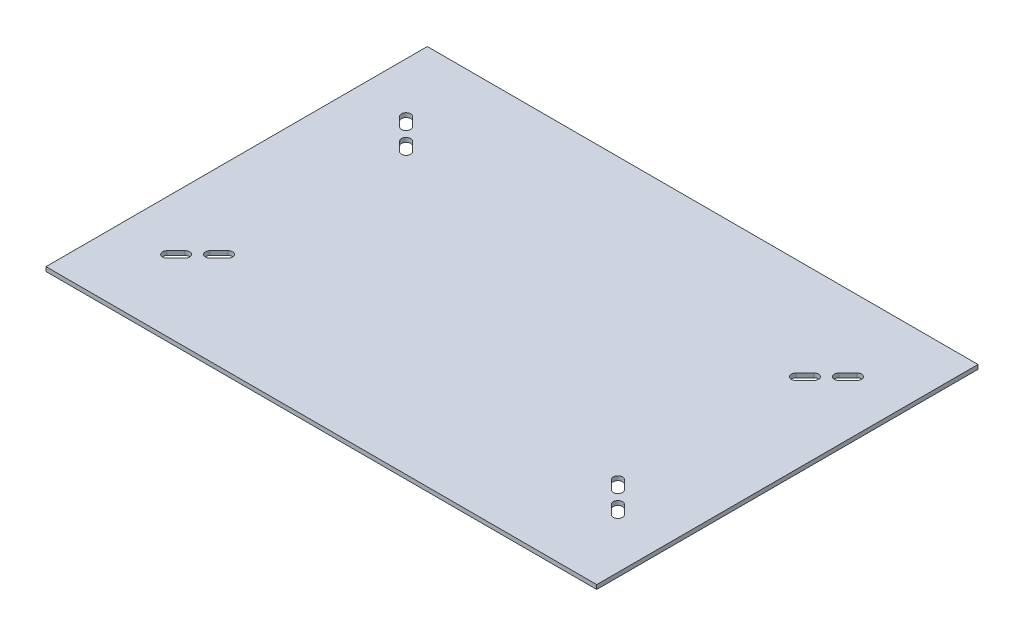
from build123d import *

# Parameters (mm, degrees)
SKETCH1_W          = 330.2
SKETCH1_H          = 228.6
BASE_PLATE_DEPTH   = 2.54
CUT_EXTRUDE9_DEPTH = 402.617294946


with BuildPart() as part:
    # Sketch1 → base plate (new body)
    with BuildSketch(Plane(origin=(0, 0, 0), x_dir=(1, 0, 0), z_dir=(0, 1, 0))):
        with Locations((165.1, -114.3)):
            Rectangle(SKETCH1_W, SKETCH1_H)
    extrude(amount=-BASE_PLATE_DEPTH)

    # Sketch3 → Cut-Extrude9 (cut, through all)
    with BuildSketch(Plane(origin=(0, 0, 0), x_dir=(1, 0, 0), z_dir=(0, 1, 0))):
        with BuildLine():
            Line((33.404828058, -178.606084521), (28.016674385, -183.994238194))
            ThreePointArc((28.016674385, -183.994238194), (28.016674385, -187.883325615), (31.905761806, -187.883325615))
            Line((31.905761806, -187.883325615), (37.293915479, -182.495171942))
            ThreePointArc((37.293915479, -182.495171942), (37.293915479, -178.606084521), (33.404828058, -178.606084521))
        make_face()
        with BuildLine():
            Line((44.775105348, -175.013982073), (50.163259021, -169.6258284))
            ThreePointArc((50.163259021, -169.6258284), (50.163259021, -165.736740979), (46.2741716, -165.736740979))
            Line((46.2741716, -165.736740979), (40.886017927, -171.124894652))
            ThreePointArc((40.886017927, -171.124894652), (40.886017927, -175.013982073), (44.775105348, -175.013982073))
        make_face()
        with BuildLine():
            ThreePointArc((31.905761806, -40.716674385), (28.016674385, -40.716674385), (28.016674385, -44.605761806))
            Line((28.016674385, -44.605761806), (33.404828058, -49.993915479))
            ThreePointArc((33.404828058, -49.993915479), (37.293915479, -49.993915479), (37.293915479, -46.104828058))
            Line((37.293915479, -46.104828058), (31.905761806, -40.716674385))
        make_face()
        with BuildLine():
            ThreePointArc((46.2741716, -62.863259021), (50.163259021, -62.863259021), (50.163259021, -58.9741716))
            Line((50.163259021, -58.9741716), (44.775105348, -53.586017927))
            ThreePointArc((44.775105348, -53.586017927), (40.886017927, -53.586017927), (40.886017927, -57.475105348))
            Line((40.886017927, -57.475105348), (46.2741716, -62.863259021))
        make_face()
        with BuildLine():
            Line((296.795171942, -49.993915479), (302.183325615, -44.605761806))
            ThreePointArc((302.183325615, -44.605761806), (302.183325615, -40.716674385), (298.294238194, -40.716674385))
            Line((298.294238194, -40.716674385), (292.906084521, -46.104828058))
            ThreePointArc((292.906084521, -46.104828058), (292.906084521, -49.993915479), (296.795171942, -49.993915479))
        make_face()
        with BuildLine():
            Line((285.424894652, -53.586017927), (280.036740979, -58.9741716))
            ThreePointArc((280.036740979, -58.9741716), (280.036740979, -62.863259021), (283.9258284, -62.863259021))
            Line((283.9258284, -62.863259021), (289.313982073, -57.475105348))
            ThreePointArc((289.313982073, -57.475105348), (289.313982073, -53.586017927), (285.424894652, -53.586017927))
        make_face()
        with BuildLine():
            ThreePointArc((283.9258284, -165.736740979), (280.036740979, -165.736740979), (280.036740979, -169.6258284))
            Line((280.036740979, -169.6258284), (285.424894652, -175.013982073))
            ThreePointArc((285.424894652, -175.013982073), (289.313982073, -175.013982073), (289.313982073, -171.124894652))
            Line((289.313982073, -171.124894652), (283.9258284, -165.736740979))
        make_face()
        with BuildLine():
            ThreePointArc((298.294238194, -187.883325615), (302.183325615, -187.883325615), (302.183325615, -183.994238194))
            Line((302.183325615, -183.994238194), (296.795171942, -178.606084521))
            ThreePointArc((296.795171942, -178.606084521), (292.906084521, -178.606084521), (292.906084521, -182.495171942))
            Line((292.906084521, -182.495171942), (298.294238194, -187.883325615))
        make_face()
    extrude(amount=-CUT_EXTRUDE9_DEPTH, mode=Mode.SUBTRACT)


solid = part.part
